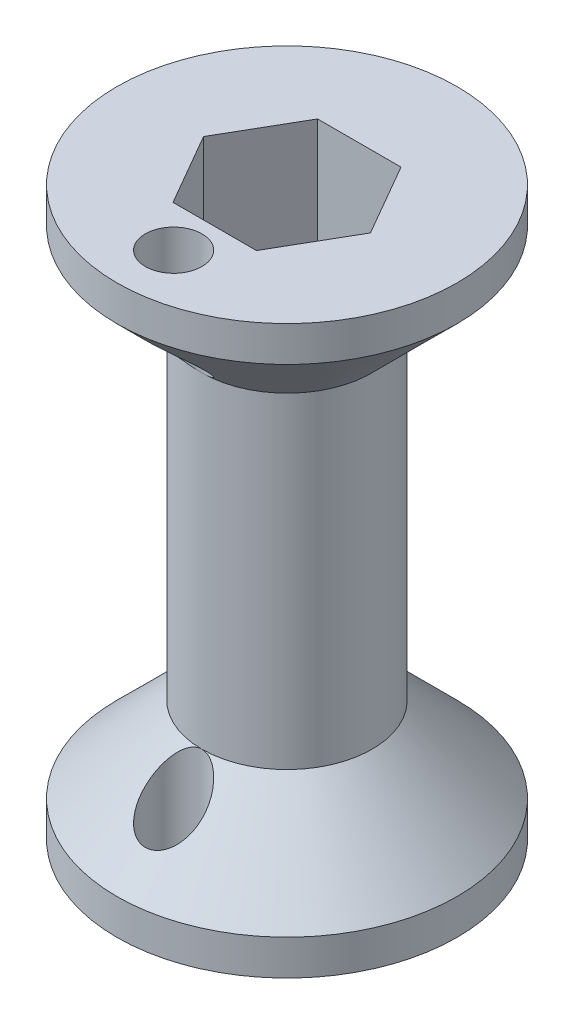
from build123d import *

# Parameters (mm, degrees)
SKETCH2_R          = 2.54
CUT_EXTRUDE1_DEPTH = 56.182924895


with BuildPart() as part:
    # Sketch1 → Revolve1 (revolve)
    with BuildSketch(Plane(origin=(0, 0, 0), x_dir=(0, 0, -1), z_dir=(1, 0, 0))):
        Polygon((0, 0), (0, 25.4), (15.24, 25.4), (15.24, 22.225), (7.62, 14.605), (7.62, 0), align=None)
    revolve1 = revolve(axis=Axis((0, 0, 0), (0, 1, 0)))

    # Mirror1: Revolve1 across plane
    add(revolve1.mirror(Plane(origin=(0, 0, -7.62), x_dir=(0, 0, 1), z_dir=(0, -1, 0))))

    # Sketch2 → Cut-Extrude1 (cut, through all)
    with BuildSketch(Plane(origin=(0, 25.4, 0), x_dir=(1, 0, 0), z_dir=(0, 1, 0))):
        with Locations((0, -10.16)):
            Circle(SKETCH2_R)
        Polygon((-7.478995387, 0), (-3.739497694, -6.477), (3.739497694, -6.477), (7.478995387, 0), (3.739497694, 6.477), (-3.739497694, 6.477), align=None)
    extrude(amount=-CUT_EXTRUDE1_DEPTH, mode=Mode.SUBTRACT)


solid = part.part
